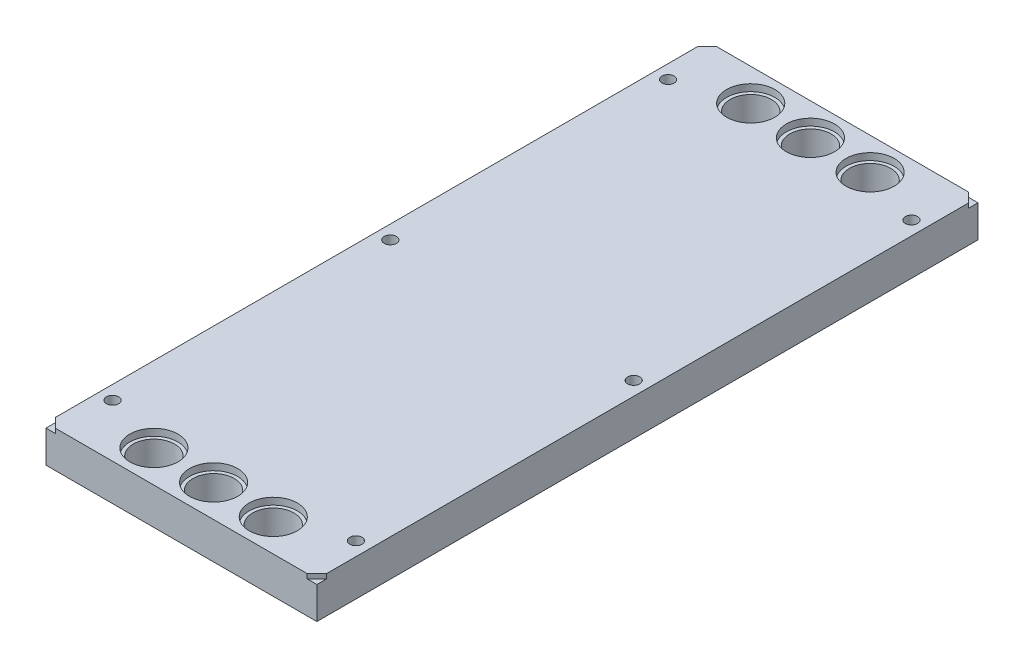
from build123d import *

# Parameters (mm, degrees)
SKETCH1_W            = 187.325
SKETCH1_H            = 25.4
BASE_EXTRUDE_DEPTH   = 228.6
CBORE1_D             = 8.4328
CBORE1_CBORE_D       = 13.49375
CBORE1_CBORE_DEPTH   = 7.9375
CBORE2_D             = 8.4328
CBORE2_CBORE_D       = 13.49375
CBORE2_CBORE_DEPTH   = 7.9375
CBORE3_D             = 8.4328
CBORE3_CBORE_D       = 13.49375
CBORE3_CBORE_DEPTH   = 7.9375
CBORE4_D             = 8.4328
CBORE4_CBORE_D       = 13.49375
CBORE4_CBORE_DEPTH   = 7.9375
CUT_EXTRUDE1_DEPTH   = 3.175
MIRROR2_COPY_1_DEPTH = 3.175
GUIDE1_START         = -25.4
GUIDE1_OUTLINE_R     = 14.2875
GUIDE1_DEPTH         = 25.4
CBORE5_START         = -25.4
CBORE5_OUTLINE_R     = 14.2875
CBORE5_OUTLINE_R_2   = 4.2164
CBORE5_DEPTH         = 25.4
CBORE5_START_2       = -4.7625
CBORE5_2_OUTLINE_R   = 16.66875
CBORE5_2_OUTLINE_R_2 = 14.2875
CBORE5_2_DEPTH       = 4.7625
CBORE5_3_OUTLINE_R   = 6.746875
CBORE5_3_OUTLINE_R_2 = 4.2164
CBORE5_3_DEPTH       = 7.9375
CBORE6_D             = 8.4328
CBORE6_CBORE_D       = 13.49375
CBORE6_CBORE_DEPTH   = 7.9375


# Read off the part's stored shape, not the designer's step: Guide1, CBORE5
with BuildPart() as part:
    # Sketch1 → Base-Extrude (new, symmetric)
    with BuildSketch(Plane.XY):
        with Locations((0, -12.7)):
            Rectangle(SKETCH1_W, SKETCH1_H)
    extrude(amount=BASE_EXTRUDE_DEPTH, both=True)

    # CBORE1 (through all)
    with Locations(Plane.XZ.offset(25.4)):
        with Locations((84.1375, -192.0875)):
            CounterBoreHole(CBORE1_D / 2, CBORE1_CBORE_D / 2, CBORE1_CBORE_DEPTH)

    # CBORE2 (through all)
    with Locations(Plane.XZ.offset(25.4)):
        with Locations((84.1375, 192.0875)):
            CounterBoreHole(CBORE2_D / 2, CBORE2_CBORE_D / 2, CBORE2_CBORE_DEPTH)

    # CBORE3 (through all)
    with Locations(Plane.XZ.offset(25.4)):
        with Locations((-84.1375, 192.0875)):
            CounterBoreHole(CBORE3_D / 2, CBORE3_CBORE_D / 2, CBORE3_CBORE_DEPTH)

    # CBORE4 (through all)
    with Locations(Plane.XZ.offset(25.4)):
        with Locations((-84.1375, -192.0875)):
            CounterBoreHole(CBORE4_D / 2, CBORE4_CBORE_D / 2, CBORE4_CBORE_DEPTH)

    # Sketch3 → Cut-Extrude1 (cut)
    with BuildSketch(Plane(origin=(0, 0, 0), x_dir=(-1, 0, 0), z_dir=(0, 1, 0))):
        Polygon((-86.927307909, 228.6), (-93.6625, 221.864807909), (-93.6625, 228.6), align=None)
    cut_extrude1 = extrude(amount=-CUT_EXTRUDE1_DEPTH, mode=Mode.SUBTRACT)

    # Mirror1: Cut-Extrude1 across plane
    add(cut_extrude1.mirror(Plane(origin=(0, 0, 0), x_dir=(0, 0, 1), z_dir=(1, 0, 0))), mode=Mode.SUBTRACT)

    # Mirror2: Cut-Extrude1 across plane
    add(cut_extrude1.mirror(Plane.XY), mode=Mode.SUBTRACT)

    # Mirror2 copy 1 sketch → Mirror2 copy 1 (cut)
    with BuildSketch(Plane(origin=(0, 0, 0), x_dir=(1, 0, 0), z_dir=(0, 1, 0))):
        Polygon((-86.927307909, 228.6), (-93.6625, 221.864807909), (-93.6625, 228.6), align=None)
    extrude(amount=-MIRROR2_COPY_1_DEPTH, mode=Mode.SUBTRACT)

    # SP1rev → SP1 (revolve, cut)
    with BuildSketch(Plane(origin=(-71.4375, -25.4, -217.4875), x_dir=(0, 0, -1), z_dir=(1, 0, 0))):
        Polygon((0, 0), (0, 18.259649766), (3.968746562, 15.87498625), (3.968746562, 0.002539998), (3.968746563, 0), align=None)
    revolve(axis=Axis((-71.4375, -31.75, -217.4875), (0, 1, 0)), mode=Mode.SUBTRACT)

    # SP2rev → SP2 (revolve, cut)
    with BuildSketch(Plane(origin=(-71.4375, -25.4, 217.4875), x_dir=(0, 0, -1), z_dir=(1, 0, 0))):
        Polygon((0, 0), (0, 18.259649766), (3.968746562, 15.87498625), (3.968746562, 0.002539998), (3.968746563, 0), align=None)
    sp2 = revolve(axis=Axis((-71.4375, -31.75, 217.4875), (0, 1, 0)), mode=Mode.SUBTRACT)

    # SP3rev → SP3 (revolve, cut)
    with BuildSketch(Plane(origin=(-71.4375, -25.4, 0.218909537), x_dir=(0, 0, -1), z_dir=(1, 0, 0))):
        Polygon((0, 0), (0, 18.259649766), (3.968746562, 15.87498625), (3.968746562, 0.002539998), (3.968746563, 0), align=None)
    sp3 = revolve(axis=Axis((-71.4375, -31.75, 0.218909537), (0, 1, 0)), mode=Mode.SUBTRACT)

    # SP4rev → SP4 (revolve, cut)
    with BuildSketch(Plane(origin=(-71.4375, -25.4, 101.6), x_dir=(0, 0, -1), z_dir=(1, 0, 0))):
        Polygon((0, 0), (0, 18.259649766), (3.968746562, 15.87498625), (3.968746562, 0.002539998), (3.968746563, 0), align=None)
    sp4 = revolve(axis=Axis((-71.4375, -31.75, 101.6), (0, 1, 0)), mode=Mode.SUBTRACT)

    # SP5rev → SP5 (revolve, cut)
    with BuildSketch(Plane(origin=(-71.4375, -25.4, -101.6), x_dir=(0, 0, -1), z_dir=(1, 0, 0))):
        Polygon((0, 0), (0, 18.259649766), (3.968746562, 15.87498625), (3.968746562, 0.002539998), (3.968746563, 0), align=None)
    sp5 = revolve(axis=Axis((-71.4375, -31.75, -101.6), (0, 1, 0)), mode=Mode.SUBTRACT)

    # SP6rev → SP6 (revolve, cut)
    with BuildSketch(Plane(origin=(71.4375, -25.4, -214.3125), x_dir=(0, 0, -1), z_dir=(1, 0, 0))):
        Polygon((0, 0), (0, 18.259649766), (3.968746562, 15.87498625), (3.968746562, 0.002539998), (3.968746563, 0), align=None)
    revolve(axis=Axis((71.4375, -31.75, -214.3125), (0, 1, 0)), mode=Mode.SUBTRACT)

    # Guide1 outline → Guide1 (cut)
    with BuildSketch(Plane(origin=(0, 0, 0), x_dir=(1, 0, 0), z_dir=(0, 1, 0)).offset(GUIDE1_START)):
        with Locations((41.275, 206.375)):
            Circle(GUIDE1_OUTLINE_R)
    extrude(amount=GUIDE1_DEPTH, mode=Mode.SUBTRACT)

    # CBORE5 outline → CBORE5 (cut)
    with BuildSketch(Plane(origin=(0, 0, 0), x_dir=(1, 0, 0), z_dir=(0, 1, 0)).offset(CBORE5_START)):
        with Locations((0, -206.375)):
            Circle(CBORE5_OUTLINE_R)
        with Locations((0, 206.375)):
            Circle(CBORE5_OUTLINE_R)
        with Locations((-41.275, 206.375)):
            Circle(CBORE5_OUTLINE_R)
        with Locations((-41.275, -206.375)):
            Circle(CBORE5_OUTLINE_R)
        with Locations((41.275, -206.375)):
            Circle(CBORE5_OUTLINE_R)
        with Locations((84.1375, 0)):
            Circle(CBORE5_OUTLINE_R_2)
    extrude(amount=CBORE5_DEPTH, mode=Mode.SUBTRACT)

    # CBORE5 2 outline → CBORE5 2 (cut)
    # profile 1 of 6: a face of its own
    with BuildSketch(Plane(origin=(0, 0, 0), x_dir=(1, 0, 0), z_dir=(0, 1, 0)).offset(CBORE5_START_2)):
        with Locations((41.275, 206.375)):
            Circle(CBORE5_2_OUTLINE_R)
        with Locations((41.275, 206.375)):
            Circle(CBORE5_2_OUTLINE_R_2, mode=Mode.SUBTRACT)
    # profile 2 of 6: a face of its own
    with BuildSketch(Plane(origin=(0, 0, 0), x_dir=(1, 0, 0), z_dir=(0, 1, 0)).offset(CBORE5_START_2)):
        with Locations((41.275, -206.375)):
            Circle(CBORE5_2_OUTLINE_R)
        with Locations((41.275, -206.375)):
            Circle(CBORE5_2_OUTLINE_R_2, mode=Mode.SUBTRACT)
    # profile 3 of 6: a face of its own
    with BuildSketch(Plane(origin=(0, 0, 0), x_dir=(1, 0, 0), z_dir=(0, 1, 0)).offset(CBORE5_START_2)):
        with Locations((-41.275, -206.375)):
            Circle(CBORE5_2_OUTLINE_R)
        with Locations((-41.275, -206.375)):
            Circle(CBORE5_2_OUTLINE_R_2, mode=Mode.SUBTRACT)
    # profile 4 of 6: a face of its own
    with BuildSketch(Plane(origin=(0, 0, 0), x_dir=(1, 0, 0), z_dir=(0, 1, 0)).offset(CBORE5_START_2)):
        with Locations((-41.275, 206.375)):
            Circle(CBORE5_2_OUTLINE_R)
        with Locations((-41.275, 206.375)):
            Circle(CBORE5_2_OUTLINE_R_2, mode=Mode.SUBTRACT)
    # profile 5 of 6: a face of its own
    with BuildSketch(Plane(origin=(0, 0, 0), x_dir=(1, 0, 0), z_dir=(0, 1, 0)).offset(CBORE5_START_2)):
        with Locations((0, 206.375)):
            Circle(CBORE5_2_OUTLINE_R)
        with Locations((0, 206.375)):
            Circle(CBORE5_2_OUTLINE_R_2, mode=Mode.SUBTRACT)
    # profile 6 of 6: a face of its own
    with BuildSketch(Plane(origin=(0, 0, 0), x_dir=(1, 0, 0), z_dir=(0, 1, 0)).offset(CBORE5_START_2)):
        with Locations((0, -206.375)):
            Circle(CBORE5_2_OUTLINE_R)
        with Locations((0, -206.375)):
            Circle(CBORE5_2_OUTLINE_R_2, mode=Mode.SUBTRACT)
    extrude(amount=CBORE5_2_DEPTH, mode=Mode.SUBTRACT)

    # CBORE5 3 outline → CBORE5 3 (cut)
    with BuildSketch(Plane(origin=(0, 0, 0), x_dir=(1, 0, 0), z_dir=(0, 1, 0)).offset(CBORE5_START)):
        with Locations((84.1375, 0)):
            Circle(CBORE5_3_OUTLINE_R)
        with Locations((84.1375, 0)):
            Circle(CBORE5_3_OUTLINE_R_2, mode=Mode.SUBTRACT)
    extrude(amount=CBORE5_3_DEPTH, mode=Mode.SUBTRACT)

    # CBORE6 (through all)
    with Locations(Plane(origin=(-174.013483356, -25.4, 84.713166839), x_dir=(1, 0, 0), z_dir=(0, -1, 0))):
        with Locations((89.875983356, -84.713166839)):
            CounterBoreHole(CBORE6_D / 2, CBORE6_CBORE_D / 2, CBORE6_CBORE_DEPTH)

    # Mirror3: SP3 across plane
    add(sp3.mirror(Plane(origin=(0, 0, 0), x_dir=(0, 0, 1), z_dir=(1, 0, 0))), mode=Mode.SUBTRACT)

    # Mirror4: SP4, SP5 across plane
    add(sp4.mirror(Plane(origin=(0, 0, 0), x_dir=(0, 0, 1), z_dir=(1, 0, 0))), mode=Mode.SUBTRACT)
    add(sp5.mirror(Plane(origin=(0, 0, 0), x_dir=(0, 0, 1), z_dir=(1, 0, 0))), mode=Mode.SUBTRACT)

    # Mirror5: SP2 across plane
    add(sp2.mirror(Plane(origin=(0, 0, 0), x_dir=(0, 0, 1), z_dir=(1, 0, 0))), mode=Mode.SUBTRACT)


solid = part.part
